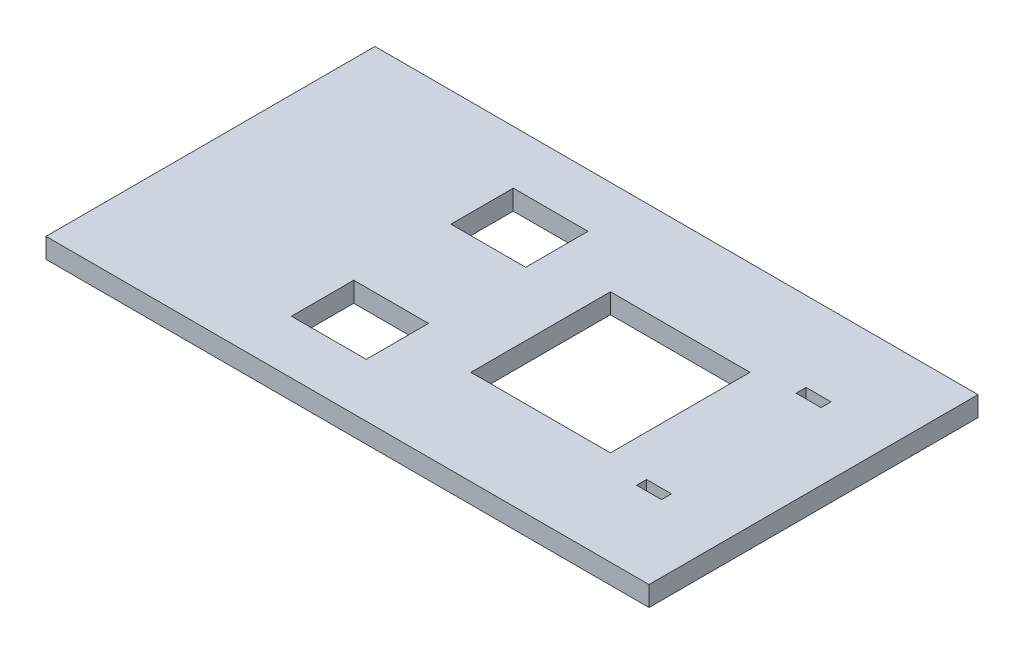
from build123d import *

# Parameters (mm, degrees)
SKETCH1_W           = 121
SKETCH1_H           = 66
BOSS_EXTRUDE1_DEPTH = 4
SKETCH2_W           = 28
SKETCH2_H           = 28
SKETCH2_W_2         = 15
SKETCH2_H_2         = 12.5
CUT_EXTRUDE1_DEPTH  = 138.887635414
SKETCH3_W           = 5
SKETCH3_H           = 2
CUT_EXTRUDE2_DEPTH  = 138.887635414


with BuildPart() as part:
    # Sketch1 → Boss-Extrude1 (new body)
    with BuildSketch(Plane(origin=(0, 0, 0), x_dir=(1, 0, 0), z_dir=(0, 1, 0))):
        with Locations((60.5, -33)):
            Rectangle(SKETCH1_W, SKETCH1_H)
    extrude(amount=BOSS_EXTRUDE1_DEPTH)

    # Sketch2 → Cut-Extrude1 (cut, through all)
    with BuildSketch(Plane(origin=(0, 4, 0), x_dir=(1, 0, 0), z_dir=(0, 1, 0))):
        with Locations((80.25, -33)):
            Rectangle(SKETCH2_W, SKETCH2_H)
        with Locations((46, -17)):
            Rectangle(SKETCH2_W_2, SKETCH2_H_2)
        with Locations((46, -49)):
            Rectangle(SKETCH2_W_2, SKETCH2_H_2)
    extrude(amount=-CUT_EXTRUDE1_DEPTH, mode=Mode.SUBTRACT)

    # Sketch3 → Cut-Extrude2 (cut, through all)
    with BuildSketch(Plane.XZ):
        with Locations((105, 49)):
            Rectangle(SKETCH3_W, SKETCH3_H)
        with Locations((105, 17)):
            Rectangle(SKETCH3_W, SKETCH3_H)
    extrude(amount=-CUT_EXTRUDE2_DEPTH, mode=Mode.SUBTRACT)


solid = part.part
